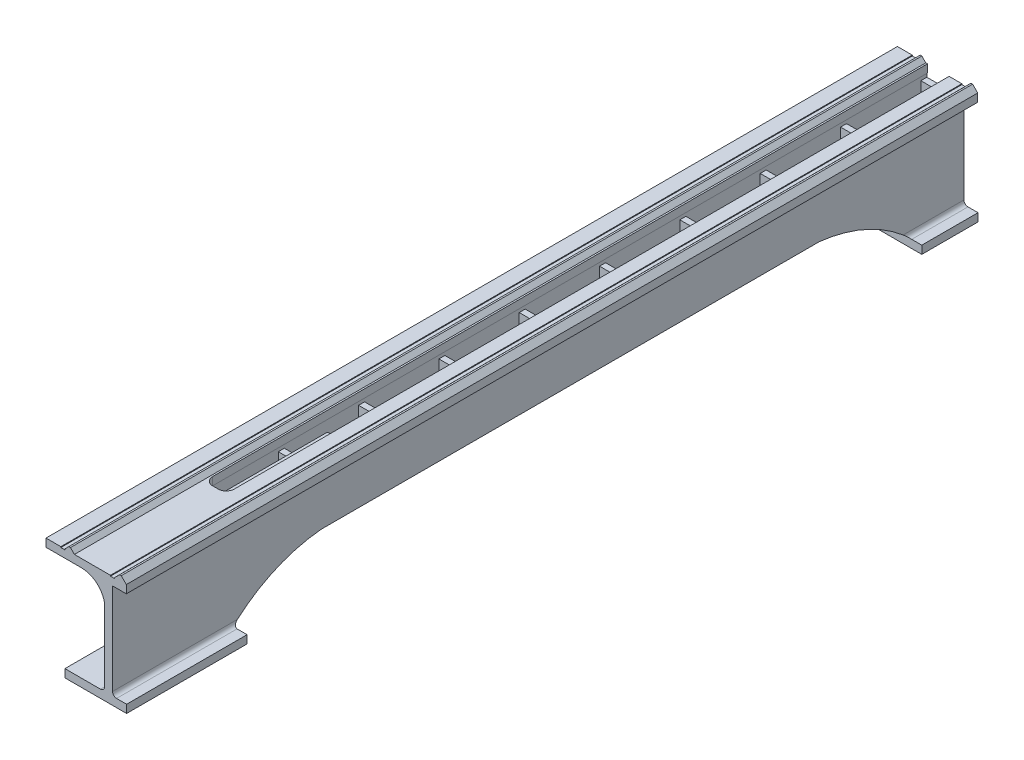
from build123d import *

# Parameters (mm, degrees)
BOSS_EXTRUDE1_DEPTH     = 1060
CUT_EXTRUDE1_DEPTH      = 800
CUT_EXTRUDE2_START      = -300
SKETCH3_W               = 36.203926591
SKETCH3_H               = 13.184166836
CUT_EXTRUDE2_DEPTH      = 900
SKETCH5_W               = 10.426623187
SKETCH5_H               = 125.292137731
BOSS_EXTRUDE2_DEPTH     = 950
SKETCH6_W               = 7.435137382
SKETCH6_H               = 64.029540506
BOSS_EXTRUDE3_DEPTH     = 50
LPATTERN1_COUNT         = 10
LPATTERN1_PITCH         = 100
CUT_EXTRUDE3_DEPTH      = 10
CUT_EXTRUDE3_DEPTH_BACK = 100


with BuildPart() as part:
    # Sketch1 → Boss-Extrude1 (new body)
    with BuildSketch(Plane.XY):
        with BuildLine():
            Line((-31.555119126, 31.290150882), (-37.853807036, 37.718722311))
            Line((-37.853807036, 37.718722311), (-39.853807036, 37.718722311))
            Line((-39.853807036, 37.718722311), (-46.282378465, 31.420034401))
            Line((-46.282378465, 31.420034401), (-46.282378465, 30.420034401))
            Line((-46.282378465, 30.420034401), (-51.282378465, 30.420034401))
            Line((-51.282378465, 30.420034401), (-51.282378465, 31.420034401))
            Line((-51.282378465, 31.420034401), (-96.206307824, 31.420034401))
            Line((-96.206307824, 31.420034401), (-101.105287309, 36.420034401))
            Line((-101.105287309, 36.420034401), (-103.105287309, 36.420034401))
            Line((-103.105287309, 36.420034401), (-108.055034777, 31.470286932))
            Line((-108.055034777, 31.470286932), (-108.055034777, 30.420034401))
            Line((-108.055034777, 30.420034401), (-113.055034777, 30.420034401))
            Line((-113.055034777, 30.420034401), (-113.055034777, 31.420034401))
            Line((-113.055034777, 31.420034401), (-131.555034777, 31.420034401))
            Line((-131.555034777, 31.420034401), (-131.555034777, 21.420034401))
            Line((-131.555034777, 21.420034401), (-87.349569261, 21.420034401))
            ThreePointArc((-87.349569261, 21.420034401), (-68.862935324, 14.835575372), (-58.701074529, -1.95273366))
            Line((-58.701074529, -1.95273366), (-58.701074529, -92.579965599))
            ThreePointArc((-58.701074529, -92.579965599), (-60.165540623, -96.115499505), (-63.701074529, -97.579965599))
            Line((-63.701074529, -97.579965599), (-108.009983562, -97.579965599))
            Line((-108.009983562, -97.579965599), (-108.009983562, -107.579965599))
            Line((-108.009983562, -107.579965599), (-31.195424592, -107.579965599))
            Line((-31.195424592, -107.579965599), (-31.195424592, -97.579965599))
            Line((-31.195424592, -97.579965599), (-43.701074529, -97.579965599))
            ThreePointArc((-43.701074529, -97.579965599), (-47.236608435, -96.115499505), (-48.701074529, -92.579965599))
            Line((-48.701074529, -92.579965599), (-48.701074529, 21.290150882))
            Line((-48.701074529, 21.290150882), (-31.555119126, 21.290150882))
            Line((-31.555119126, 21.290150882), (-31.555119126, 31.290150882))
        make_face()
    extrude(amount=BOSS_EXTRUDE1_DEPTH)

    # Sketch2 → Cut-Extrude1 (cut)
    with BuildSketch(Plane(origin=(0, 20.764722339, 0), x_dir=(1, 0, 0), z_dir=(0, 1, 0))):
        with BuildLine():
            Line((-84.170689991, 100), (-77.170689991, 100))
            ThreePointArc((-77.170689991, 100), (-70.099622179, 97.071067812), (-67.170689991, 90))
            Line((-67.170689991, 90), (-67.170689991, -890))
            ThreePointArc((-67.170689991, -890), (-70.099622179, -897.071067812), (-77.170689991, -900))
            Line((-77.170689991, -900), (-84.170689991, -900))
            ThreePointArc((-84.170689991, -900), (-91.241757803, -897.071067812), (-94.170689991, -890))
            Line((-94.170689991, -890), (-94.170689991, 90))
            ThreePointArc((-94.170689991, 90), (-91.241757803, 97.071067812), (-84.170689991, 100))
        make_face()
    extrude(amount=CUT_EXTRUDE1_DEPTH, mode=Mode.SUBTRACT)

    # Sketch3 → Cut-Extrude2 (cut)
    with BuildSketch(Plane.XY.offset(1060).offset(CUT_EXTRUDE2_START)):
        with Locations((-75.865548737, 14.689788087)):
            Rectangle(SKETCH3_W, SKETCH3_H)
    extrude(amount=-CUT_EXTRUDE2_DEPTH, mode=Mode.SUBTRACT)

    # Sketch5 → Boss-Extrude2 (add)
    with BuildSketch(Plane(origin=(0, 0, 0), x_dir=(-1, 0, 0), z_dir=(0, 0, -1))):
        with Locations((100.133130522, -34.849417223)):
            Rectangle(SKETCH5_W, SKETCH5_H)
    extrude(amount=-BOSS_EXTRUDE2_DEPTH)

    # Sketch6 → Boss-Extrude3 (add)
    with BuildSketch(Plane.ZY.offset(105.346442115)):
        with Locations((3.717568691, -15.430068515)):
            Rectangle(SKETCH6_W, SKETCH6_H)
    boss_extrude3 = extrude(amount=-BOSS_EXTRUDE3_DEPTH)

    # LPattern1: Boss-Extrude3 ×10
    with Locations(*[(0, 0, i * LPATTERN1_PITCH) for i in range(1, LPATTERN1_COUNT)]):
        add(boss_extrude3)

    # Sketch4 → Cut-Extrude3 (cut, two sides: drawn at the far end of the back side and taken through both)
    with BuildSketch(Plane(origin=(-31.555119126, 0, 0), x_dir=(0, 0, -1), z_dir=(1, 0, 0)).offset(-CUT_EXTRUDE3_DEPTH_BACK)):
        with BuildLine():
            Line((-910, -97.579965599), (-910, -107.579965599))
            Line((-910, -107.579965599), (-910, -177.956634241))
            Line((-910, -177.956634241), (-70, -177.956634241))
            Line((-70, -177.956634241), (-70, -97.579965599))
            ThreePointArc((-70, -97.579965599), (-121.056751887, -63.823667059), (-180.068799532, -47.579965599))
            Line((-180.068799532, -47.579965599), (-800, -47.579965599))
            ThreePointArc((-800, -47.579965599), (-859.23910305, -63.253938888), (-910, -97.579965599))
        make_face()
    extrude(amount=CUT_EXTRUDE3_DEPTH + CUT_EXTRUDE3_DEPTH_BACK, mode=Mode.SUBTRACT)


solid = part.part
